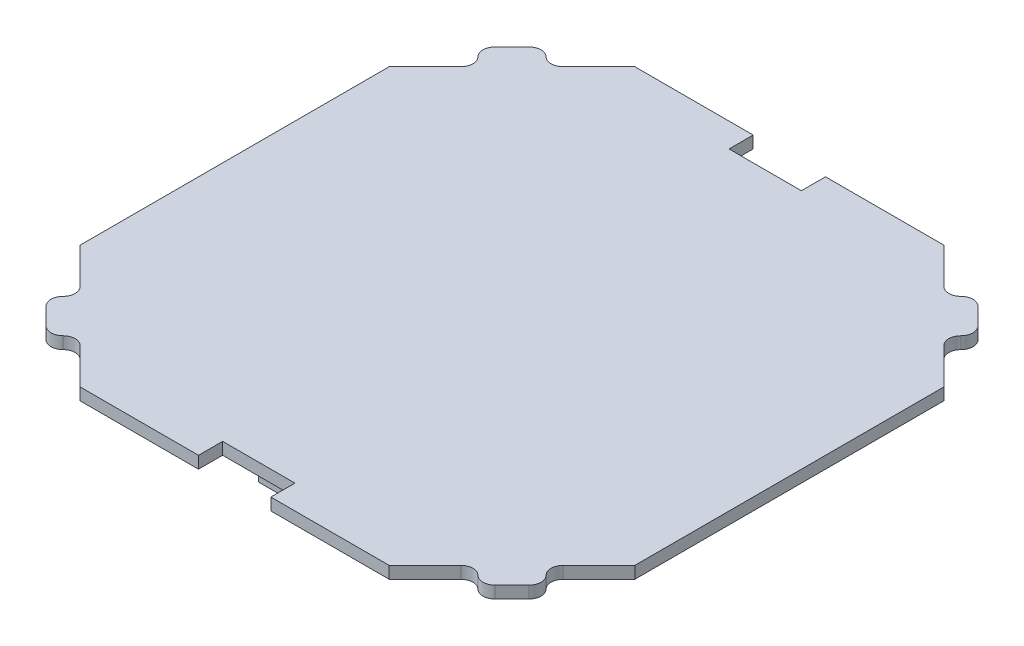
from build123d import *

# Parameters (mm, degrees)
SZKIC1_W                        = 230
SZKIC1_H                        = 230
DODANIE_WYCI_GNI_CIE1_DEPTH     = 5
WYTNIJ_WYCI_GNI_CIE1_DEPTH      = 163.711400953
ZAOKR_GLENIE2_R                 = 5
SZYK_KO_OWY1_COUNT              = 4
ZAOKR_GLENIE2_OF_SZYK_KO_OWY1_R = 5
SZKIC3_W                        = 30
SZKIC3_H                        = 10
WYTNIJ_WYCI_GNI_CIE2_DEPTH      = 163.711400953
SZKIC4_W                        = 20.455701668
SZKIC4_H                        = 190
DODANIE_WYCI_GNI_CIE2_DEPTH     = 5
SZKIC5_W                        = 3
SZKIC5_H                        = 10
DODANIE_WYCI_GNI_CIE3_DEPTH     = 4.25
SZKIC6_W                        = 20.455701668
SZKIC6_H                        = 10.031438373
DODANIE_WYCI_GNI_CIE4_DEPTH     = 3
SZYK_LINIOWY1_COUNT             = 8
SZYK_LINIOWY1_PITCH             = 25.7


with BuildPart() as part:
    # Szkic1 → Dodanie-wyciągnięcie1 (new body)
    with BuildSketch(Plane(origin=(0, 0, 0), x_dir=(1, 0, 0), z_dir=(0, 1, 0))):
        Rectangle(SZKIC1_W, SZKIC1_H)
    extrude(amount=DODANIE_WYCI_GNI_CIE1_DEPTH)

    # Szkic2 → Wytnij-wyciągnięcie1 (cut, symmetric)
    with BuildSketch(Plane(origin=(0, 5, 0), x_dir=(1, 0, 0), z_dir=(0, 1, 0))):
        Polygon((-115, 115), (-64.088311755, 115), (-82.473088065, 96.615223689), (-89.544155877, 103.686291501), (-103.686291501, 89.544155877), (-96.615223689, 82.473088065), (-115, 64.088311755), align=None)
    wytnij_wyci_gni_cie1 = extrude(amount=WYTNIJ_WYCI_GNI_CIE1_DEPTH, both=True, mode=Mode.SUBTRACT)

    # Zaokrąglenie2
    zaokr_glenie2_edges = [part.edges().sort_by_distance(p)[0] for p in [
        (-82.473088065, 2.5, -96.615223689),
        (-96.615223689, 2.5, -82.473088065),
    ]]
    fillet(zaokr_glenie2_edges, radius=ZAOKR_GLENIE2_R)
    zaokr_glenie2_2_edges = [part.edges().sort_by_distance(p)[0] for p in [
        (-89.544155877, 2.5, -103.686291501),
        (-103.686291501, 2.5, -89.544155877),
    ]]
    fillet(zaokr_glenie2_2_edges, radius=ZAOKR_GLENIE2_R - 0.0001)  # a hair under: the kernel refuses the full size

    # Szyk kołowy1: Wytnij-wyciągnięcie1 ×4 about axis
    szyk_ko_owy1_axis = Axis((0, 0, 0), (0, 1, 0))
    for i in range(1, SZYK_KO_OWY1_COUNT):
        add(wytnij_wyci_gni_cie1.rotate(szyk_ko_owy1_axis, i * 360 / SZYK_KO_OWY1_COUNT), mode=Mode.SUBTRACT)

    # Zaokrąglenie2 of Szyk kołowy1
    zaokr_glenie2_of_szyk_ko_owy1_edges = [part.edges().sort_by_distance(p)[0] for p in [
        (-96.615223689, 2.5, 82.473088065),
        (-82.473088065, 2.5, 96.615223689),
        (82.473088065, 2.5, 96.615223689),
        (96.615223689, 2.5, 82.473088065),
        (96.615223689, 2.5, -82.473088065),
        (82.473088065, 2.5, -96.615223689),
    ]]
    fillet(zaokr_glenie2_of_szyk_ko_owy1_edges, radius=ZAOKR_GLENIE2_OF_SZYK_KO_OWY1_R)
    zaokr_glenie2_of_szyk_ko_owy1_2_edges = [part.edges().sort_by_distance(p)[0] for p in [
        (-103.686291501, 2.5, 89.544155877),
        (-89.544155877, 2.5, 103.686291501),
        (89.544155877, 2.5, 103.686291501),
        (103.686291501, 2.5, 89.544155877),
        (103.686291501, 2.5, -89.544155877),
        (89.544155877, 2.5, -103.686291501),
    ]]
    fillet(zaokr_glenie2_of_szyk_ko_owy1_2_edges, radius=ZAOKR_GLENIE2_OF_SZYK_KO_OWY1_R - 0.0001)  # a hair under: the kernel refuses the full size

    # Szkic3 → Wytnij-wyciągnięcie2 (cut, through all)
    with BuildSketch(Plane(origin=(0, 5, 0), x_dir=(1, 0, 0), z_dir=(0, 1, 0))):
        with Locations((0, -110)):
            Rectangle(SZKIC3_W, SZKIC3_H)
    wytnij_wyci_gni_cie2 = extrude(amount=-WYTNIJ_WYCI_GNI_CIE2_DEPTH, mode=Mode.SUBTRACT)

    # Lustro1: Wytnij-wyciągnięcie2 across plane
    add(wytnij_wyci_gni_cie2.mirror(Plane.XY), mode=Mode.SUBTRACT)

    # Szkic4 → Dodanie-wyciągnięcie2 (add)
    with BuildSketch(Plane.XZ):
        Rectangle(SZKIC4_W, SZKIC4_H)
    extrude(amount=DODANIE_WYCI_GNI_CIE2_DEPTH)

    # Szkic5 → Dodanie-wyciągnięcie3 (add)
    with BuildSketch(Plane.XZ.offset(5)):
        with Locations((8.727850834, -90)):
            Rectangle(SZKIC5_W, SZKIC5_H)
        with Locations((-8.727850834, -90)):
            Rectangle(SZKIC5_W, SZKIC5_H)
    dodanie_wyci_gni_cie3 = extrude(amount=DODANIE_WYCI_GNI_CIE3_DEPTH)

    # Szkic6 → Dodanie-wyciągnięcie4 (add)
    with BuildSketch(Plane.XZ.offset(9.25)):
        with Locations((0, -89.984280813)):
            Rectangle(SZKIC6_W, SZKIC6_H)
    dodanie_wyci_gni_cie4 = extrude(amount=DODANIE_WYCI_GNI_CIE4_DEPTH)

    # Szyk liniowy1: Dodanie-wyciągnięcie3, Dodanie-wyciągnięcie4 ×8
    with Locations(*[(0, 0, i * SZYK_LINIOWY1_PITCH) for i in range(1, SZYK_LINIOWY1_COUNT)]):
        add(dodanie_wyci_gni_cie3)
        add(dodanie_wyci_gni_cie4)


solid = part.part
